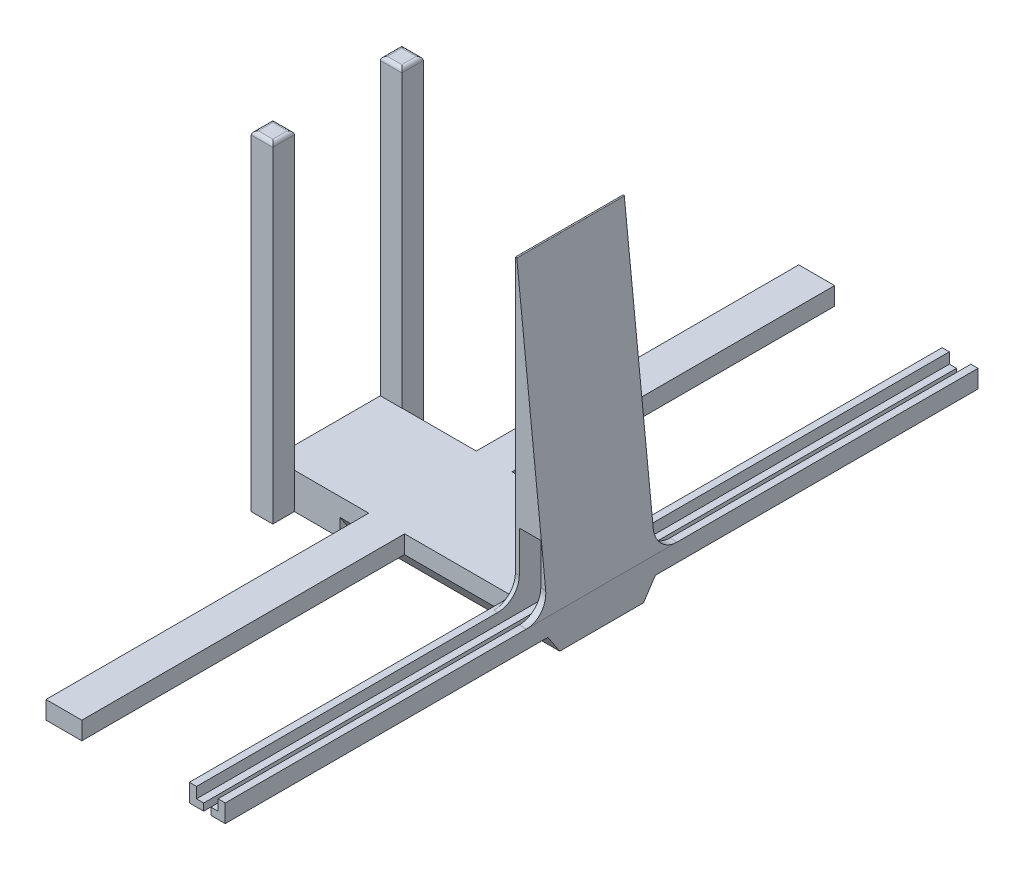
from build123d import *

# Parameters (mm, degrees)
SKETCH1_W           = 5
SKETCH1_H           = 105
BOSS_EXTRUDE1_DEPTH = 5
BOSS_EXTRUDE2_START = 129
BOSS_EXTRUDE2_DEPTH = 15
BOSS_EXTRUDE3_START = 129
SKETCH3_W           = 33.371379062
SKETCH3_H           = 5
BOSS_EXTRUDE3_DEPTH = 15
SKETCH4_W           = 3
SKETCH4_H           = 3.016632821
SKETCH4_H_2         = 3
BOSS_EXTRUDE4_DEPTH = 46
FILLET1_R           = 0.5
FILLET2_R           = 0.1
FILLET3_R           = 3
LPATTERN2_COUNT     = 2
LPATTERN2_PITCH     = 20
CUT_EXTRUDE3_DEPTH  = 29
CUT_EXTRUDE4_DEPTH  = 106


with BuildPart() as part:
    # Sketch1 → Boss-Extrude1 (new body)
    with BuildSketch(Plane(origin=(0, -9.496519724, 0), x_dir=(1, 0, 0), z_dir=(0, 1, 0))):
        with Locations((177.597354305, -136.516632821)):
            Rectangle(SKETCH1_W, SKETCH1_H)
    boss_extrude1 = extrude(amount=BOSS_EXTRUDE1_DEPTH)

    # Sketch2 → Boss-Extrude2 (add)
    with BuildSketch(Plane(origin=(0, -9.496519724, 0), x_dir=(1, 0, 0), z_dir=(0, 0, 1)).offset(BOSS_EXTRUDE2_START)):
        Polygon((180.097354305, 5), (175.549258031, 48.019997969), (175.549258031, 5), align=None)
    extrude(amount=BOSS_EXTRUDE2_DEPTH)

    # Sketch3 → Boss-Extrude3 (add)
    with BuildSketch(Plane(origin=(0, -9.496519724, 0), x_dir=(1, 0, 0), z_dir=(0, 0, 1)).offset(BOSS_EXTRUDE3_START)):
        with Locations((158.411664774, 2.5)):
            Rectangle(SKETCH3_W, SKETCH3_H)
    extrude(amount=BOSS_EXTRUDE3_DEPTH)

    # Sketch4 → Boss-Extrude4 (add)
    with BuildSketch(Plane(origin=(0, -9.496519724, 0), x_dir=(1, 0, 0), z_dir=(0, 1, 0))):
        with Locations((143.225975243, -145.508316411)):
            Rectangle(SKETCH4_W, SKETCH4_H)
        with Locations((143.225975243, -127.516632821)):
            Rectangle(SKETCH4_W, SKETCH4_H_2)
    extrude(amount=BOSS_EXTRUDE4_DEPTH)

    # Fillet1
    fillet1_edges = [part.edges().sort_by_distance(p)[0] for p in [
        (143.225975243, 36.503480276, 129.016632821),
        (141.725975243, 36.503480276, 127.516632821),
        (143.225975243, 36.503480276, 126.016632821),
        (144.725975243, 36.503480276, 127.516632821),
        (143.225975243, 36.503480276, 147.016632821),
        (141.725975243, 36.503480276, 145.50831641),
        (143.225975243, 36.503480276, 144),
        (144.725975243, 36.503480276, 145.50831641),
    ]]
    fillet(fillet1_edges, radius=FILLET1_R)

    # Fillet2
    fillet2_edges = [part.edges().sort_by_distance(p)[0] for p in [
        (175.549258031, 38.523478245, 136.5),
    ]]
    fillet(fillet2_edges, radius=FILLET2_R)

    # Fillet3
    fillet3_edges = [part.edges().sort_by_distance(p)[0] for p in [
        (177.823306168, -4.496519724, 129),
        (177.823306168, -4.496519724, 144),
    ]]
    fillet(fillet3_edges, radius=FILLET3_R)

    # LPattern2: Boss-Extrude1 ×2
    with Locations(*[(-i * LPATTERN2_PITCH, 0, 0) for i in range(1, LPATTERN2_COUNT)]):
        add(boss_extrude1)

    # Sketch7 → Cut-Extrude3 (cut)
    with BuildSketch(Plane(origin=(180.097354305, 0, 0), x_dir=(0, 0, -1), z_dir=(1, 0, 0))):
        Polygon((-189.016632821, -6.996519724), (-189.016632821, -9.496519724), (-142.358320426, -9.496519724), (-144.016632821, -6.996519724), align=None)
        Polygon((-129.016632821, -6.996519724), (-130.674945216, -9.496519724), (-84.016632821, -9.496519724), (-84.016632821, -6.996519724), align=None)
    extrude(amount=-CUT_EXTRUDE3_DEPTH, mode=Mode.SUBTRACT)

    # Sketch11 → Cut-Extrude4 (cut)
    with BuildSketch(Plane(origin=(0, 0, 84.016632821), x_dir=(-1, 0, 0), z_dir=(0, 0, -1))):
        Polygon((-178.097354305, -6.996519724), (-178.097354305, -5.996519724), (-179.097354305, -5.996519724), (-179.097354305, 4.208174), (-176.097354305, 4.208174), (-176.097354305, -5.996519724), (-177.097354305, -5.996519724), (-177.097354305, -6.996519724), align=None)
    extrude(amount=-CUT_EXTRUDE4_DEPTH, mode=Mode.SUBTRACT)


solid = part.part
